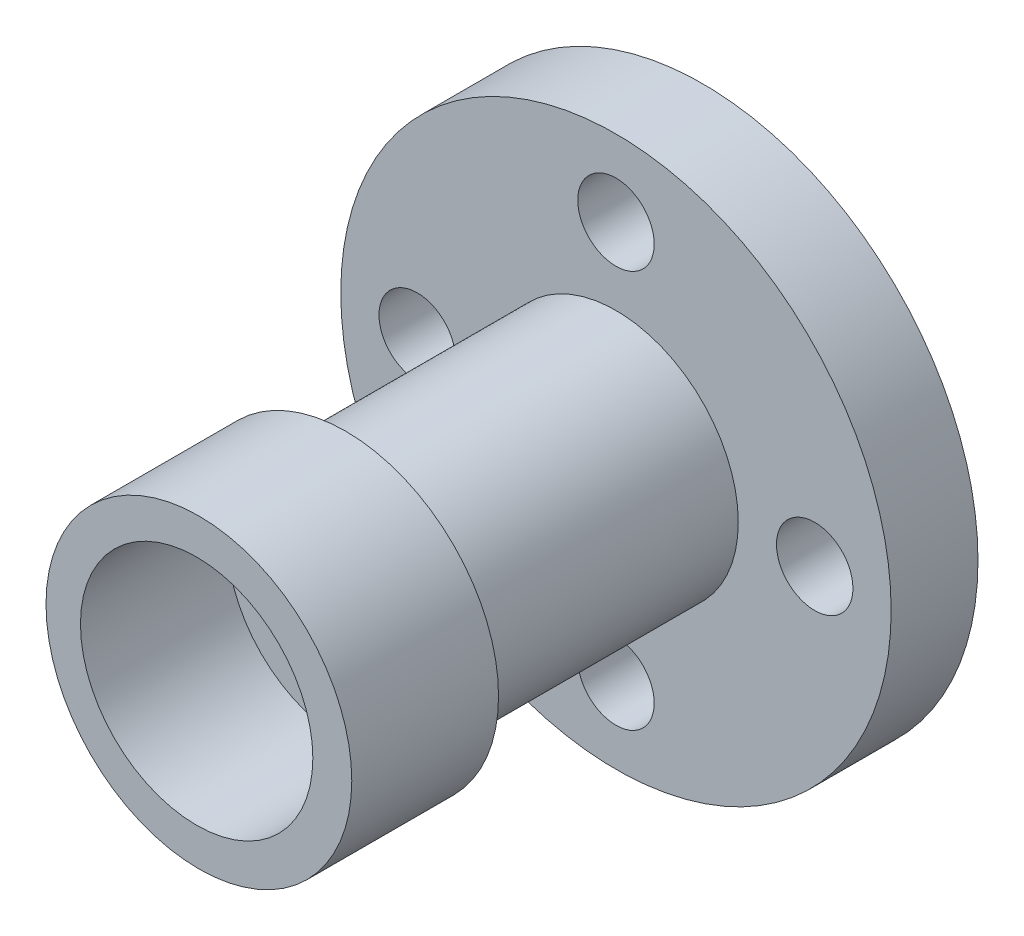
from build123d import *

# Parameters (mm, degrees)
CROQUIS1_R              = 45
CROQUIS1_R_2            = 15
SALIENTE_EXTRUIR1_DEPTH = 14.2
CROQUIS3_R              = 20
CROQUIS3_R_2            = 15
SALIENTE_EXTRUIR2_DEPTH = 44.2
CROQUIS6_R              = 25
CROQUIS6_R_2            = 19
SALIENTE_EXTRUIR3_DEPTH = 24
CHAFL_N1_SIZE           = 3
CHAFL_N1_SIZE2          = 3.5
CROQUIS10_R             = 6.25
CORTAR_EXTRUIR1_DEPTH   = 44.2


with BuildPart() as part:
    # Croquis1 → Saliente-Extruir1 (new body)
    with BuildSketch(Plane.XY):
        Circle(CROQUIS1_R)
        Circle(CROQUIS1_R_2, mode=Mode.SUBTRACT)
    extrude(amount=SALIENTE_EXTRUIR1_DEPTH)

    # Croquis3 → Saliente-Extruir2 (add)
    with BuildSketch(Plane.XY.offset(14.2)):
        Circle(CROQUIS3_R)
        Circle(CROQUIS3_R_2, mode=Mode.SUBTRACT)
    extrude(amount=SALIENTE_EXTRUIR2_DEPTH)

    # Croquis6 → Saliente-Extruir3 (add)
    with BuildSketch(Plane.XY.offset(58.4)):
        Circle(CROQUIS6_R)
        with Locations((-0.365479273, 0)):
            Circle(CROQUIS6_R_2, mode=Mode.SUBTRACT)
    extrude(amount=SALIENTE_EXTRUIR3_DEPTH)

    # Chaflán1
    chafl_n1_edges = [part.edges().sort_by_distance(p)[0] for p in [
        (-15, 0, 0),
    ]]
    chafl_n1_side = [part.faces().sort_by_distance(p)[0] for p in [
        (-15, 0, 29.2),
    ]]
    chamfer(chafl_n1_edges, length=CHAFL_N1_SIZE, length2=CHAFL_N1_SIZE2, reference=chafl_n1_side[0])

    # Croquis10 → Cortar-Extruir1 (cut)
    with BuildSketch(Plane(origin=(0, 0, 0), x_dir=(-1, 0, 0), z_dir=(0, 0, -1))):
        with Locations((0, 32.5)):
            Circle(CROQUIS10_R)
        with Locations((32.5, 0)):
            Circle(CROQUIS10_R)
        with Locations((0, -32.5)):
            Circle(CROQUIS10_R)
        with Locations((-32.5, 0)):
            Circle(CROQUIS10_R)
    extrude(amount=-CORTAR_EXTRUIR1_DEPTH, mode=Mode.SUBTRACT)


solid = part.part
